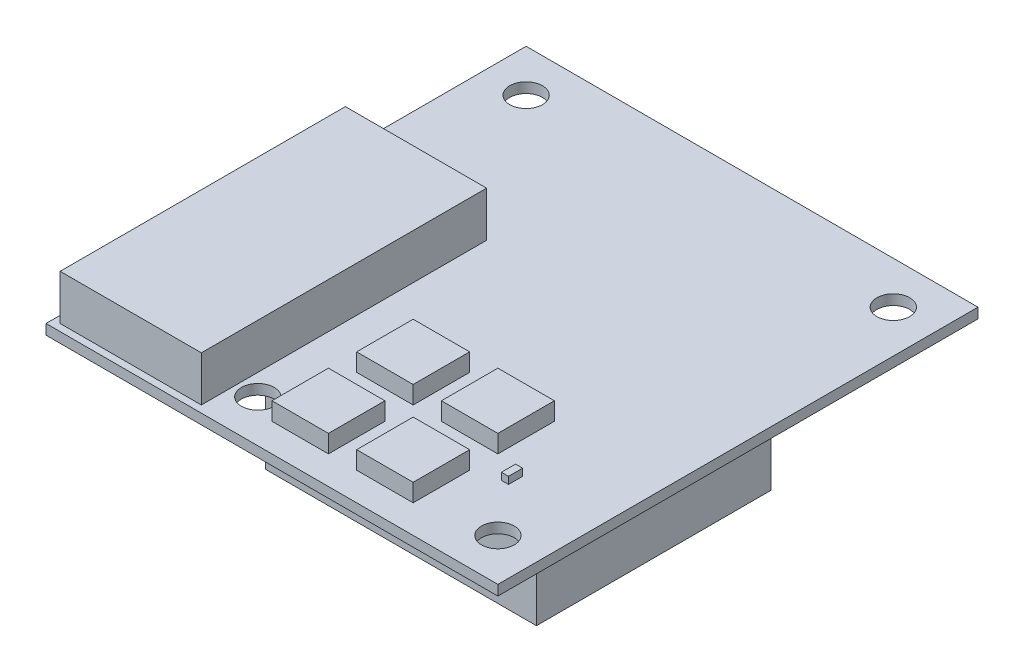
from build123d import *

# Parameters (mm, degrees)
SKETCH1_W                       = 40.64
SKETCH1_H                       = 43.18
BOSS_EXTRUDE1_DEPTH             = 0.9144
SKETCH3_W                       = 5.08
SKETCH3_H                       = 5.08
BOSS_EXTRUDE2_DEPTH             = 1.6
SKETCH4_W                       = 12.7
SKETCH4_H                       = 25.654
BOSS_EXTRUDE3_DEPTH             = 4.064
F_32_0_116_DIAMETER_HOLE1_D     = 2.9464
F_32_0_116_DIAMETER_HOLE1_DEPTH = 25.4
F_32_0_116_DIAMETER_HOLE1_TIP   = 0.885187864
SKETCH8_W                       = 0.635
SKETCH8_H                       = 1.27
BOSS_EXTRUDE4_DEPTH             = 0.635
BOSS_EXTRUDE5_DEPTH             = 10.9982
BOSS_EXTRUDE6_DEPTH             = 7.09


with BuildPart() as part:
    # Sketch1 → Boss-Extrude1 (new body)
    with BuildSketch(Plane(origin=(0, 0, 0), x_dir=(1, 0, 0), z_dir=(0, 1, 0))):
        with Locations((20.32, 21.59)):
            Rectangle(SKETCH1_W, SKETCH1_H)
    extrude(amount=BOSS_EXTRUDE1_DEPTH)

    # Sketch3 → Boss-Extrude2 (add)
    with BuildSketch(Plane(origin=(0, 0.9144, 0), x_dir=(1, 0, 0), z_dir=(0, 1, 0))):
        with Locations((20.32, 12.7)):
            Rectangle(SKETCH3_W, SKETCH3_H)
        with Locations((27.94, 12.7)):
            Rectangle(SKETCH3_W, SKETCH3_H)
        with Locations((27.94, 5.08)):
            Rectangle(SKETCH3_W, SKETCH3_H)
        with Locations((20.32, 5.08)):
            Rectangle(SKETCH3_W, SKETCH3_H)
    extrude(amount=BOSS_EXTRUDE2_DEPTH)

    # Sketch4 → Boss-Extrude3 (add)
    with BuildSketch(Plane(origin=(0, 0.9144, 0), x_dir=(1, 0, 0), z_dir=(0, 1, 0))):
        with Locations((6.985, 13.462)):
            Rectangle(SKETCH4_W, SKETCH4_H)
    extrude(amount=BOSS_EXTRUDE3_DEPTH)

    # #32 (0.116) Diameter Hole1
    with Locations(Plane(origin=(0, 0.9144, 0), x_dir=(1, 0, 0), z_dir=(0, 1, 0))):
        with Locations((3.81, 39.37), (36.83, 39.37), (36.83, 3.81), (15.24, 3.81)):
            Hole(F_32_0_116_DIAMETER_HOLE1_D / 2, depth=F_32_0_116_DIAMETER_HOLE1_DEPTH)
            with Locations((0, 0, -(F_32_0_116_DIAMETER_HOLE1_DEPTH + F_32_0_116_DIAMETER_HOLE1_TIP / 2))):  # 118° drill point
                Cone(0, F_32_0_116_DIAMETER_HOLE1_D / 2, F_32_0_116_DIAMETER_HOLE1_TIP, mode=Mode.SUBTRACT)

    # Sketch8 → Boss-Extrude4 (add)
    with BuildSketch(Plane(origin=(0, 0.9144, 0), x_dir=(1, 0, 0), z_dir=(0, 1, 0))):
        with Locations((33.02, 8.89)):
            Rectangle(SKETCH8_W, SKETCH8_H)
    extrude(amount=BOSS_EXTRUDE4_DEPTH)

    # Sketch10 → Boss-Extrude5 (add)
    with BuildSketch(Plane.XZ):
        Polygon((-0.665093512, -32.856376789), (10.445155464, -42.178982607), (16.224844536, -35.291017393), (5.114595559, -25.968411574), align=None)
    extrude(amount=BOSS_EXTRUDE5_DEPTH)

    # Sketch11 → Boss-Extrude6 (add)
    with BuildSketch(Plane.XZ):
        Polygon((37.592, -27.5971), (29.9974, -34.1249), (20.8026, -34.1249), (13.208, -27.5971), (13.208, -6.5151), (37.592, -6.5151), align=None)
    extrude(amount=BOSS_EXTRUDE6_DEPTH)


solid = part.part
